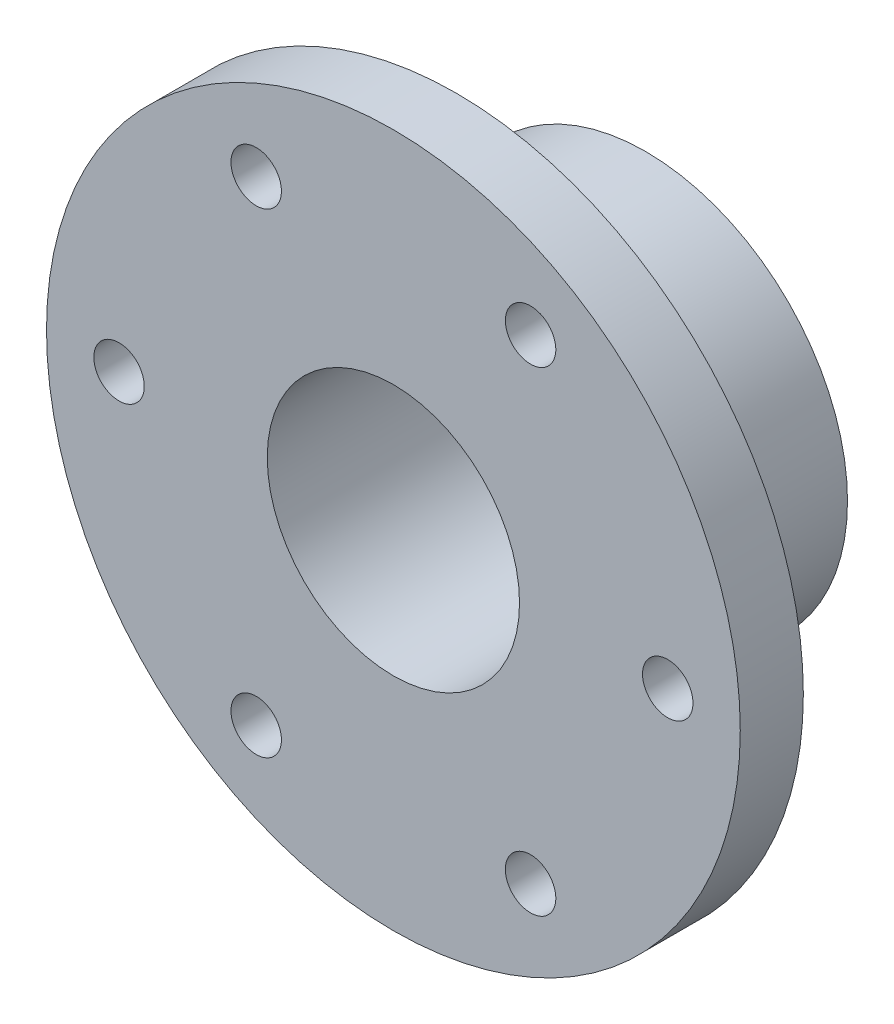
from build123d import *

# Parameters (mm, degrees)
SKETCH_1_R          = 27.5
EXTRUDE_1_DEPTH     = 5
SKETCH_2_R          = 10
CUT_EXTRUDE_2_DEPTH = 40.210967853
EXTRUDE_START       = 15
SKETCH_2_12_R       = 16
SKETCH_2_12_R_2     = 10
EXTRUDE_9_DEPTH     = 15
SKETCH_12_R         = 2
CUT_EXTRUDE_3_DEPTH = 42.683330001
CHAMFER_1_SIZE      = 0.5


with BuildPart() as part:
    # Эскиз1 → Бобышка-Вытянуть1 (new body)
    with BuildSketch(Plane.XY):
        Circle(SKETCH_1_R)
    extrude(amount=EXTRUDE_1_DEPTH)

    # Эскиз2 → Вырез-Вытянуть2 (cut, through all)
    with BuildSketch(Plane(origin=(0, 0, 0), x_dir=(-1, 0, 0), z_dir=(0, 0, -1))):
        Circle(SKETCH_2_R)
    extrude(amount=-CUT_EXTRUDE_2_DEPTH, mode=Mode.SUBTRACT)

    # Эскиз2<12> → Бобышка-Вытянуть9 (add)
    with BuildSketch(Plane(origin=(0, 0, 0), x_dir=(-1, 0, 0), z_dir=(0, 0, -1)).offset(EXTRUDE_START)):
        Circle(SKETCH_2_12_R)
        Circle(SKETCH_2_12_R_2, mode=Mode.SUBTRACT)
    extrude(amount=-EXTRUDE_9_DEPTH)

    # Эскиз12 → Вырез-Вытянуть3 (cut, through all)
    with BuildSketch(Plane(origin=(0, 0, 0), x_dir=(-1, 0, 0), z_dir=(0, 0, -1))):
        with Locations((-21.75, 0)):
            Circle(SKETCH_12_R)
        with Locations((-10.875, 18.836052532)):
            Circle(SKETCH_12_R)
        with Locations((10.875, 18.836052532)):
            Circle(SKETCH_12_R)
        with Locations((21.75, 0)):
            Circle(SKETCH_12_R)
        with Locations((10.875, -18.836052532)):
            Circle(SKETCH_12_R)
        with Locations((-10.875, -18.836052532)):
            Circle(SKETCH_12_R)
    extrude(amount=-CUT_EXTRUDE_3_DEPTH, mode=Mode.SUBTRACT)

    # Фаска1
    chamfer_1_edges = [part.edges().sort_by_distance(p)[0] for p in [
        (-19.75, 0, 0),
        (-8.875, -18.836052532, 0),
        (12.875, -18.836052532, 0),
        (23.75, 0, 0),
        (-8.875, 18.836052532, 0),
        (12.875, 18.836052532, 0),
    ]]
    chamfer(chamfer_1_edges, length=CHAMFER_1_SIZE)


solid = part.part
